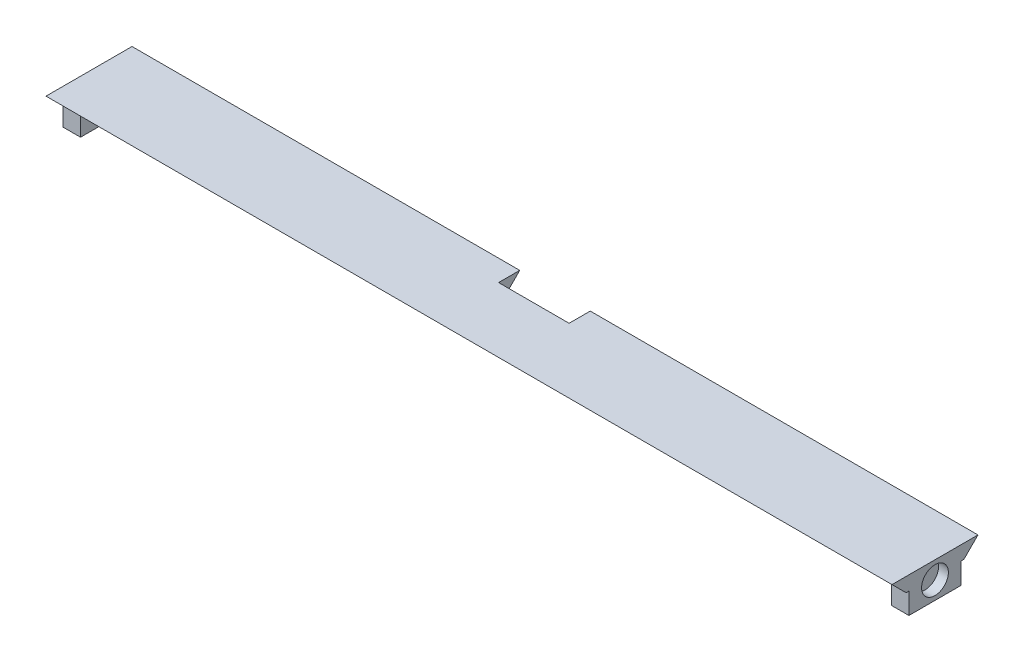
from build123d import *

# Parameters (mm, degrees)
BOSS_EXTRU_2_DEPTH      = 2
CHANFREIN2_SIZE         = 2
ESQUISSE6_W             = 2.5
ESQUISSE6_H             = 7.4
BOSS_EXTRU_5_DEPTH      = 3
ENL_V_MAT_EXTRU_5_DEPTH = 1.4
ENL_V_START             = -1.4
ENL_V_MAT_EXTRU_6_DEPTH = 1.4


with BuildPart() as part:
    # Esquisse1 → Boss.-Extru.2 (new body)
    with BuildSketch(Plane(origin=(0, 0, 0), x_dir=(1, 0, 0), z_dir=(0, 1, 0))):
        Polygon((0, 12.2), (0, 0), (120, 0), (120, 12.2), (65, 12.2), (65, 9.2), (55, 9.2), (55, 12.2), align=None)
    extrude(amount=BOSS_EXTRU_2_DEPTH)

    # Chanfrein2
    chanfrein2_edges = [part.edges().sort_by_distance(p)[0] for p in [
        (92.5, 0, -12.2),
        (27.5, 0, -12.2),
        (60, 0, -9.2),
        (60, 0, 0),
    ]]
    chamfer(chanfrein2_edges, length=CHANFREIN2_SIZE - 0.0001)  # a hair under: the kernel refuses the full size

    # Esquisse6 → Boss.-Extru.5 (add)
    with BuildSketch(Plane.XZ):
        with Locations((1.25, -6.1)):
            Rectangle(ESQUISSE6_W, ESQUISSE6_H)
        with Locations((118.75, -6.1)):
            Rectangle(ESQUISSE6_W, ESQUISSE6_H)
    extrude(amount=BOSS_EXTRU_5_DEPTH)

    # Esquisse9 → Enlèv. mat.-Extru.5 (cut)
    with BuildSketch(Plane.ZY):
        with BuildLine():
            ThreePointArc((-4.2, -0.5), (-4.235817666, -0.132815816), (-4.341920237, 0.220524493))
            Line((-4.341920237, 0.220524493), (-7.858079763, -1.220524493))
            ThreePointArc((-7.858079763, -1.220524493), (-5.732815816, -2.364182334), (-4.2, -0.5))
        make_face()
        with BuildLine():
            Line((-7.858079763, -1.220524493), (-4.341920237, 0.220524493))
            ThreePointArc((-4.341920237, 0.220524493), (-6.820524493, 1.258079763), (-7.858079763, -1.220524493))
        make_face()
    extrude(amount=-ENL_V_MAT_EXTRU_5_DEPTH, mode=Mode.SUBTRACT)

    # Esquisse10 → Enlèv. mat.-Extru.6 (cut)
    with BuildSketch(Plane(origin=(120, 0, 0), x_dir=(0, 0, -1), z_dir=(1, 0, 0)).offset(ENL_V_START)):
        with BuildLine():
            ThreePointArc((8, -0.5), (7.964182334, -0.132815816), (7.858079763, 0.220524493))
            Line((7.858079763, 0.220524493), (4.341920237, -1.220524493))
            ThreePointArc((4.341920237, -1.220524493), (6.467184184, -2.364182334), (8, -0.5))
        make_face()
        with BuildLine():
            Line((4.341920237, -1.220524493), (7.858079763, 0.220524493))
            ThreePointArc((7.858079763, 0.220524493), (5.379475507, 1.258079763), (4.341920237, -1.220524493))
        make_face()
    extrude(amount=ENL_V_MAT_EXTRU_6_DEPTH, mode=Mode.SUBTRACT)


solid = part.part
